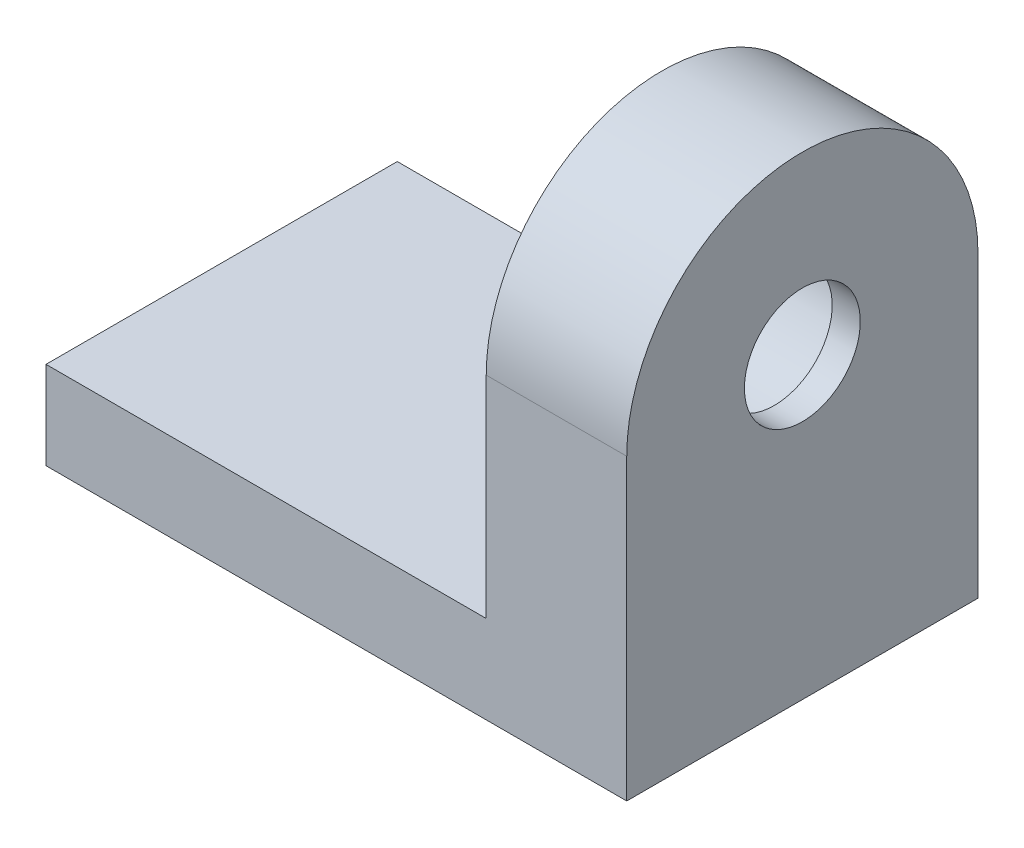
from build123d import *
from build123d.topology import SkipClean

# Parameters (mm, degrees)
BOSS_EXTRUDE1_DEPTH                                 = 8
CBORE_FOR_M6_HEX_SOCKET_HEAD_CAP_SCREW1_D           = 6.6
CBORE_FOR_M6_HEX_SOCKET_HEAD_CAP_SCREW1_DEPTH       = 30
CBORE_FOR_M6_HEX_SOCKET_HEAD_CAP_SCREW1_CBORE_D     = 11
CBORE_FOR_M6_HEX_SOCKET_HEAD_CAP_SCREW1_CBORE_DEPTH = 6.4
CBORE_FOR_M6_HEX_SOCKET_HEAD_CAP_SCREW1_TIP         = 1.982840043
SKETCH5_W                                           = 20
SKETCH5_H                                           = 5
BOSS_EXTRUDE2_DEPTH                                 = 25.065
SKETCH8_R                                           = 1.5
CUT_EXTRUDE1_DEPTH                                  = 5
THREAD1_PITCH                                       = 0.5
THREAD2_PITCH                                       = 0.5


with BuildPart() as part:
    # Sketch1 → Boss-Extrude1 (new body)
    with BuildSketch(Plane(origin=(0, 0, 0), x_dir=(0, 0, -1), z_dir=(1, 0, 0))):
        with BuildLine():
            Line((-10, 0), (-10, -17))
            Line((-10, -17), (10, -17))
            Line((10, -17), (10, 0))
            ThreePointArc((10, 0), (0, 10), (-10, 0))
        make_face()
    extrude(amount=BOSS_EXTRUDE1_DEPTH)

    # CBORE for M6 Hex Socket Head Cap Screw1
    with Locations(Plane.ZY):
        with Locations((0, 0)):
            CounterBoreHole(CBORE_FOR_M6_HEX_SOCKET_HEAD_CAP_SCREW1_D / 2, CBORE_FOR_M6_HEX_SOCKET_HEAD_CAP_SCREW1_CBORE_D / 2, CBORE_FOR_M6_HEX_SOCKET_HEAD_CAP_SCREW1_CBORE_DEPTH, depth=CBORE_FOR_M6_HEX_SOCKET_HEAD_CAP_SCREW1_DEPTH)
            with Locations((0, 0, -(CBORE_FOR_M6_HEX_SOCKET_HEAD_CAP_SCREW1_DEPTH + CBORE_FOR_M6_HEX_SOCKET_HEAD_CAP_SCREW1_TIP / 2))):  # 118° drill point
                Cone(0, CBORE_FOR_M6_HEX_SOCKET_HEAD_CAP_SCREW1_D / 2, CBORE_FOR_M6_HEX_SOCKET_HEAD_CAP_SCREW1_TIP, mode=Mode.SUBTRACT)

    # Sketch5 → Boss-Extrude2 (add)
    with BuildSketch(Plane.ZY):
        with Locations((0, -14.5)):
            Rectangle(SKETCH5_W, SKETCH5_H)
    extrude(amount=BOSS_EXTRUDE2_DEPTH)

    # Sketch8 → Cut-Extrude1 (cut)
    with BuildSketch(Plane.ZY.offset(25.065)):
        with Locations((6, -14.5)):
            Circle(SKETCH8_R)
        with Locations((-6, -14.5)):
            Circle(SKETCH8_R)
    extrude(amount=-CUT_EXTRUDE1_DEPTH, mode=Mode.SUBTRACT)

    # Thread1: the profile of Thread Profile1 profile screwed along a right-hand helix of 20 turns, 6 arcs to a turn; built about Z, then put on its axis
    with SkipClean():  # the faces are left unmerged after this step: merging them gives an invalid solid
        thread1_z = Axis((0, 0, 0), (0, 0, 1))
        thread1_corners = [(1.4997, 0, -0.000173205), (1.770632938, 0, 0.156249999), (1.770632938, 0, 0.218749999), (1.4997, 0, 0.375173204)]
        with BuildLine(mode=Mode.PRIVATE) as thread1_profile:
            Line(thread1_corners[0], thread1_corners[1])
            Line(thread1_corners[1], thread1_corners[2])
            Line(thread1_corners[2], thread1_corners[3])
            Line(thread1_corners[3], thread1_corners[0])
        thread1_cap = Face(thread1_profile.wire())
        thread1_turn_angles = [0, 30, 60, 90, 120, 150, 180, 210, 240, 270, 300, 330, 360]
        thread1_turn_weights = [1, 0.8660254037844387, 1, 0.8660254037844387, 1, 0.8660254037844387, 1, 0.8660254037844387, 1, 0.8660254037844387, 1, 0.8660254037844387, 1]
        thread1_turn_rails = [Edge.make_bspline([Vector(p[0], p[1], 0).rotate(thread1_z, thread1_turn_angles[k]) / thread1_turn_weights[k] + Vector(0, 0, p[2] + THREAD1_PITCH * thread1_turn_angles[k] / 360) for k in range(13)], [0, 0, 0, 1, 1, 2, 2, 3, 3, 4, 4, 5, 5, 6, 6, 6], 2, thread1_turn_weights) for p in thread1_corners]
        thread1_turn_sides = [Face.make_surface_from_curves(thread1_turn_rails[p[0]], thread1_turn_rails[p[1]]) for p in [(0, 1), (1, 2), (2, 3), (3, 0)]]
        thread1 = Plane(origin=(-25.065, -14.5, 6), x_dir=(0, 0, -1), z_dir=(1, 0, 0)) * Solid(Shell([*[p.moved(Location((0, 0, THREAD1_PITCH * i))) for i in range(20) for p in thread1_turn_sides], thread1_cap, thread1_cap.rotate(thread1_z, 7200).moved(Location((0, 0, THREAD1_PITCH * 7200 / 360)))]))
        add(thread1, mode=Mode.SUBTRACT)

    # Thread2: the profile of Thread Profile2 profile screwed along a right-hand helix of 20 turns, 6 arcs to a turn; built about Z, then put on its axis
    with SkipClean():  # the faces are left unmerged after this step: merging them gives an invalid solid
        thread2_z = Axis((0, 0, 0), (0, 0, 1))
        thread2_corners = [(1.4997, 0, -0.000173205), (1.770632937, 0, 0.156249999), (1.770632937, 0, 0.218749999), (1.4997, 0, 0.375173204)]
        with BuildLine(mode=Mode.PRIVATE) as thread2_profile:
            Line(thread2_corners[0], thread2_corners[1])
            Line(thread2_corners[1], thread2_corners[2])
            Line(thread2_corners[2], thread2_corners[3])
            Line(thread2_corners[3], thread2_corners[0])
        thread2_cap = Face(thread2_profile.wire())
        thread2_turn_angles = [0, 30, 60, 90, 120, 150, 180, 210, 240, 270, 300, 330, 360]
        thread2_turn_weights = [1, 0.8660254037844387, 1, 0.8660254037844387, 1, 0.8660254037844387, 1, 0.8660254037844387, 1, 0.8660254037844387, 1, 0.8660254037844387, 1]
        thread2_turn_rails = [Edge.make_bspline([Vector(p[0], p[1], 0).rotate(thread2_z, thread2_turn_angles[k]) / thread2_turn_weights[k] + Vector(0, 0, p[2] + THREAD2_PITCH * thread2_turn_angles[k] / 360) for k in range(13)], [0, 0, 0, 1, 1, 2, 2, 3, 3, 4, 4, 5, 5, 6, 6, 6], 2, thread2_turn_weights) for p in thread2_corners]
        thread2_turn_sides = [Face.make_surface_from_curves(thread2_turn_rails[p[0]], thread2_turn_rails[p[1]]) for p in [(0, 1), (1, 2), (2, 3), (3, 0)]]
        thread2 = Plane(origin=(-25.065, -14.5, -6), x_dir=(0, 0, -1), z_dir=(1, 0, 0)) * Solid(Shell([*[p.moved(Location((0, 0, THREAD2_PITCH * i))) for i in range(20) for p in thread2_turn_sides], thread2_cap, thread2_cap.rotate(thread2_z, 7200).moved(Location((0, 0, THREAD2_PITCH * 7200 / 360)))]))
        add(thread2, mode=Mode.SUBTRACT)


solid = part.part
